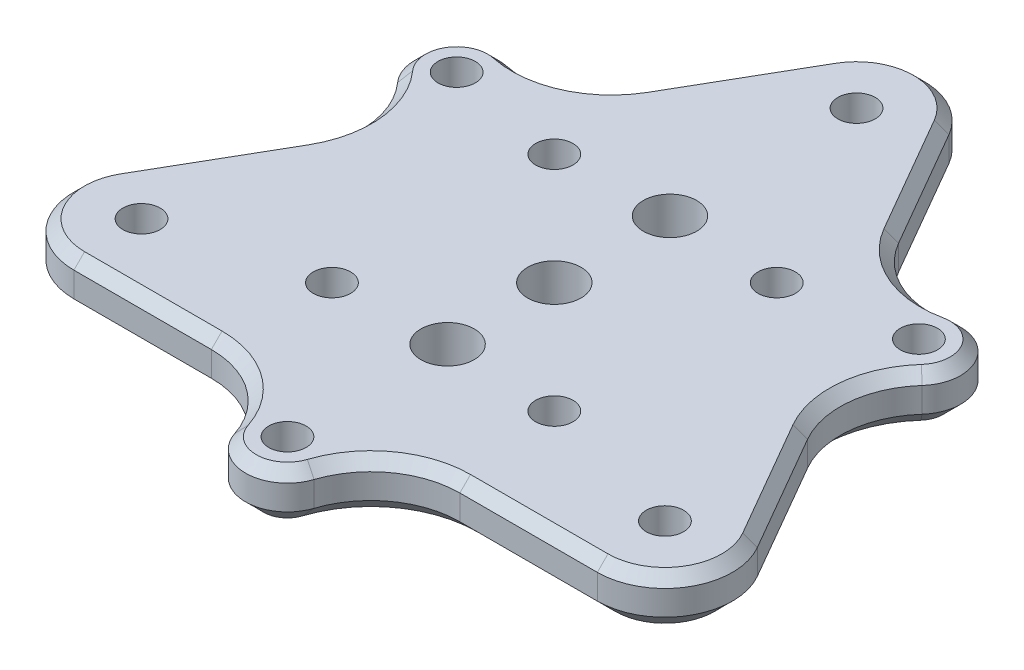
from build123d import *

# Parameters (mm, degrees)
SKETCH_1_R           = 2.1
SKETCH_1_R_2         = 5
EXTRUDE_1_DEPTH      = 6
FILLET_1_R           = 10
CHAMFER_1_SIZE       = 1.2
CHAMFER_3_SIZE       = 2
SKETCH_3_R           = 3
CUT_EXTRUDE_4_DEPTH  = 15
SKETCH_4_R           = 5
CUT_EXTRUDE_9_DEPTH  = 2
CUT_EXTRUDE_11_REACH = 57.806
SKETCH_5_R           = 2.1
CUT_EXTRUDE_12_REACH = 57.985
SKETCH_6_R           = 3
CHAMFER_4_SIZE       = 0.25
EXTRUDE_START        = -4
SKETCH_8_R           = 5
SKETCH_8_R_2         = 2.1
EXTRUDE_4_DEPTH      = 4
SKETCH_9_R           = 5
SKETCH_9_R_2         = 2.1
EXTRUDE_5_DEPTH      = 4


with BuildPart() as part:
    # ｽｹｯﾁ1 → ﾎﾞｽ - 押し出し1 (new body)
    with BuildSketch(Plane(origin=(0, 0, 0), x_dir=(1, 0, 0), z_dir=(0, 1, 0))):
        with BuildLine():
            Line((-18.940896534, 16.362624243), (-23.630762114, 19.070319398))
            ThreePointArc((-23.630762114, 19.070319398), (-30.051081511, 17.35), (-28.330762114, 10.929680602))
            Line((-28.330762114, 10.929680602), (-23.640896534, 8.221985447))
            Line((-23.640896534, 8.221985447), (-35.999999999, -13.18460969))
            ThreePointArc((-35.999999999, -13.18460969), (-35.999999999, -20.78460969), (-29.41820693, -24.58460969))
            Line((-29.41820693, -24.58460969), (-4.7, -24.58460969))
            Line((-4.7, -24.58460969), (-4.7, -30))
            ThreePointArc((-4.7, -30), (0, -34.7), (4.7, -30))
            Line((4.7, -30), (4.7, -24.58460969))
            Line((4.7, -24.58460969), (29.41820693, -24.58460969))
            ThreePointArc((29.41820693, -24.58460969), (35.999999999, -20.78460969), (35.999999999, -13.18460969))
            Line((35.999999999, -13.18460969), (23.640896534, 8.221985447))
            Line((23.640896534, 8.221985447), (28.330762114, 10.929680602))
            ThreePointArc((28.330762114, 10.929680602), (30.051081511, 17.35), (23.630762114, 19.070319398))
            Line((23.630762114, 19.070319398), (18.940896534, 16.362624243))
            Line((18.940896534, 16.362624243), (6.581793069, 37.76921938))
            ThreePointArc((6.581793069, 37.76921938), (0, 41.56921938), (-6.581793069, 37.76921938))
            Line((-6.581793069, 37.76921938), (-18.940896534, 16.362624243))
        make_face()
        with Locations((-25.980762114, 15)):
            Circle(SKETCH_1_R, mode=Mode.SUBTRACT)
        with Locations((0, 33.96921938)):
            Circle(SKETCH_1_R_2, mode=Mode.SUBTRACT)
        with Locations((29.41820693, -16.98460969)):
            Circle(SKETCH_1_R_2, mode=Mode.SUBTRACT)
        with Locations((-29.41820693, -16.98460969)):
            Circle(SKETCH_1_R_2, mode=Mode.SUBTRACT)
        with Locations((25.980762114, 15)):
            Circle(SKETCH_1_R, mode=Mode.SUBTRACT)
        with Locations((0, -30)):
            Circle(SKETCH_1_R, mode=Mode.SUBTRACT)
    extrude(amount=EXTRUDE_1_DEPTH)

    # ﾌｨﾚｯﾄ1
    fillet_1_edges = [part.edges().sort_by_distance(p)[0] for p in [
        (-23.640896534, 3, -8.221985447),
        (-18.940896534, 3, -16.362624243),
        (18.940896534, 3, -16.362624243),
        (23.640896534, 3, -8.221985447),
        (4.7, 3, 24.58460969),
        (-4.7, 3, 24.58460969),
    ]]
    fillet(fillet_1_edges, radius=FILLET_1_R)

    # 面取り1
    chamfer_1_edges = [part.edges().sort_by_distance(p)[0] for p in [
        (35.999999999, 6, 20.78460969),
        (21.692500811, 6, 24.58460969),
        (32.137146939, 6, 6.493951929),
        (26.987767107, 6, -6.227022046),
        (30.051081511, 6, -17.35),
        (18.886642835, 6, -20.258580883),
        (10.444646128, 6, -31.078561619),
        (0, 6, -41.56921938),
        (-10.444646128, 6, -31.078561619),
        (-18.886642835, 6, -20.258580883),
        (-30.051081511, 6, -17.35),
        (-26.987767107, 6, -6.227022046),
        (-32.137146939, 6, 6.493951929),
        (-35.999999999, 6, 20.78460969),
        (-21.692500811, 6, 24.58460969),
        (-8.101124272, 6, 26.485602929),
        (0, 6, 34.7),
        (8.101124272, 6, 26.485602929),
    ]]
    chamfer(chamfer_1_edges, length=CHAMFER_1_SIZE)

    # 面取り3
    chamfer_3_edges = [part.edges().sort_by_distance(p)[0] for p in [
        (-18.886642835, 0, -20.258580883),
        (-10.444646128, 0, -31.078561619),
        (0, 0, -41.56921938),
        (10.444646128, 0, -31.078561619),
        (18.886642835, 0, -20.258580883),
        (30.051081511, 0, -17.35),
        (26.987767107, 0, -6.227022046),
        (32.137146939, 0, 6.493951929),
        (35.999999999, 0, 20.78460969),
        (21.692500811, 0, 24.58460969),
        (8.101124272, 0, 26.485602929),
        (0, 0, 34.7),
        (-8.101124272, 0, 26.485602929),
        (-21.692500811, 0, 24.58460969),
        (-35.999999999, 0, 20.78460969),
        (-32.137146939, 0, 6.493951929),
        (-26.987767107, 0, -6.227022046),
        (-30.051081511, 0, -17.35),
    ]]
    chamfer(chamfer_3_edges, length=CHAMFER_3_SIZE)

    # ｽｹｯﾁ3 → ｶｯﾄ - 押し出し4 (cut)
    with BuildSketch(Plane.XZ):
        Circle(SKETCH_3_R)
    extrude(amount=-CUT_EXTRUDE_4_DEPTH, mode=Mode.SUBTRACT)

    # ｽｹｯﾁ4 → ｶｯﾄ - 押し出し9 (cut)
    with BuildSketch(Plane.XZ):
        with Locations((-12.5, 12.5)):
            Circle(SKETCH_4_R)
        with Locations((12.5, 12.5)):
            Circle(SKETCH_4_R)
        with Locations((12.5, -12.5)):
            Circle(SKETCH_4_R)
        with Locations((-12.5, -12.5)):
            Circle(SKETCH_4_R)
    extrude(amount=-CUT_EXTRUDE_9_DEPTH, mode=Mode.SUBTRACT)

    # ｽｹｯﾁ5 → ｶｯﾄ - 押し出し11 (cut, up to next)
    with BuildSketch(Plane.XZ.offset(-2), mode=Mode.PRIVATE) as cut_extrude_11_sk1:
        with Locations((12.5, 12.5)):
            Circle(SKETCH_5_R)
    cut_extrude_11_tool1 = extrude(cut_extrude_11_sk1.sketch, amount=-CUT_EXTRUDE_11_REACH, mode=Mode.PRIVATE) & part.part
    # ｽｹｯﾁ5 → ｶｯﾄ - 押し出し11 (cut, up to next)
    with BuildSketch(Plane.XZ.offset(-2), mode=Mode.PRIVATE) as cut_extrude_11_sk2:
        with Locations((-12.5, 12.5)):
            Circle(SKETCH_5_R)
    cut_extrude_11_tool2 = extrude(cut_extrude_11_sk2.sketch, amount=-CUT_EXTRUDE_11_REACH, mode=Mode.PRIVATE) & part.part
    # ｽｹｯﾁ5 → ｶｯﾄ - 押し出し11 (cut, up to next)
    with BuildSketch(Plane.XZ.offset(-2), mode=Mode.PRIVATE) as cut_extrude_11_sk3:
        with Locations((-12.5, -12.5)):
            Circle(SKETCH_5_R)
    cut_extrude_11_tool3 = extrude(cut_extrude_11_sk3.sketch, amount=-CUT_EXTRUDE_11_REACH, mode=Mode.PRIVATE) & part.part
    # ｽｹｯﾁ5 → ｶｯﾄ - 押し出し11 (cut, up to next)
    with BuildSketch(Plane.XZ.offset(-2), mode=Mode.PRIVATE) as cut_extrude_11_sk4:
        with Locations((12.5, -12.5)):
            Circle(SKETCH_5_R)
    cut_extrude_11_tool4 = extrude(cut_extrude_11_sk4.sketch, amount=-CUT_EXTRUDE_11_REACH, mode=Mode.PRIVATE) & part.part
    add(cut_extrude_11_tool1.solids().sort_by_distance((12.5, 2, 12.5))[0], mode=Mode.SUBTRACT)
    add(cut_extrude_11_tool2.solids().sort_by_distance((-12.5, 2, 12.5))[0], mode=Mode.SUBTRACT)
    add(cut_extrude_11_tool3.solids().sort_by_distance((-12.5, 2, -12.5))[0], mode=Mode.SUBTRACT)
    add(cut_extrude_11_tool4.solids().sort_by_distance((12.5, 2, -12.5))[0], mode=Mode.SUBTRACT)

    # ｽｹｯﾁ6 → ｶｯﾄ - 押し出し12 (cut, up to next)
    with BuildSketch(Plane(origin=(0, 0, 0), x_dir=(-1, 0, 0), z_dir=(0, -1, 0)), mode=Mode.PRIVATE) as cut_extrude_12_sk1:
        with Locations((0, 13)):
            Circle(SKETCH_6_R)
    cut_extrude_12_tool1 = extrude(cut_extrude_12_sk1.sketch, amount=-CUT_EXTRUDE_12_REACH, mode=Mode.PRIVATE) & part.part
    # ｽｹｯﾁ6 → ｶｯﾄ - 押し出し12 (cut, up to next)
    with BuildSketch(Plane(origin=(0, 0, 0), x_dir=(-1, 0, 0), z_dir=(0, -1, 0)), mode=Mode.PRIVATE) as cut_extrude_12_sk2:
        with Locations((0, -12)):
            Circle(SKETCH_6_R)
    cut_extrude_12_tool2 = extrude(cut_extrude_12_sk2.sketch, amount=-CUT_EXTRUDE_12_REACH, mode=Mode.PRIVATE) & part.part
    add(cut_extrude_12_tool1.solids().sort_by_distance((0, 0, -13))[0], mode=Mode.SUBTRACT)
    add(cut_extrude_12_tool2.solids().sort_by_distance((0, 0, 12))[0], mode=Mode.SUBTRACT)

    # 面取り4
    chamfer_4_edges = [part.edges().sort_by_distance(p)[0] for p in [
        (7.5, 0, 12.5),
        (7.5, 0, -12.5),
        (-17.5, 0, -12.5),
        (-17.5, 0, 12.5),
    ]]
    chamfer(chamfer_4_edges, length=CHAMFER_4_SIZE)

    # ｽｹｯﾁ8 → ﾎﾞｽ - 押し出し4 (add)
    with BuildSketch(Plane(origin=(0, 6, 0), x_dir=(1, 0, 0), z_dir=(0, 1, 0)).offset(EXTRUDE_START)):
        with Locations((29.41820693, -16.98460969)):
            Circle(SKETCH_8_R)
        with Locations((29.41820693, -16.98460969)):
            Circle(SKETCH_8_R_2, mode=Mode.SUBTRACT)
    extrude(amount=EXTRUDE_4_DEPTH)

    # ｽｹｯﾁ9 → ﾎﾞｽ - 押し出し5 (add)
    # profile 1 of 2: a face of its own
    with BuildSketch(Plane(origin=(0, 6, 0), x_dir=(1, 0, 0), z_dir=(0, 1, 0)).offset(EXTRUDE_START)):
        with Locations((0, 33.96921938)):
            Circle(SKETCH_9_R)
        with Locations((0, 33.96921938)):
            Circle(SKETCH_9_R_2, mode=Mode.SUBTRACT)
    # profile 2 of 2: a face of its own
    with BuildSketch(Plane(origin=(0, 6, 0), x_dir=(1, 0, 0), z_dir=(0, 1, 0)).offset(EXTRUDE_START)):
        with Locations((-29.41820693, -16.98460969)):
            Circle(SKETCH_9_R)
        with Locations((-29.41820693, -16.98460969)):
            Circle(SKETCH_9_R_2, mode=Mode.SUBTRACT)
    extrude(amount=EXTRUDE_5_DEPTH)


solid = part.part
